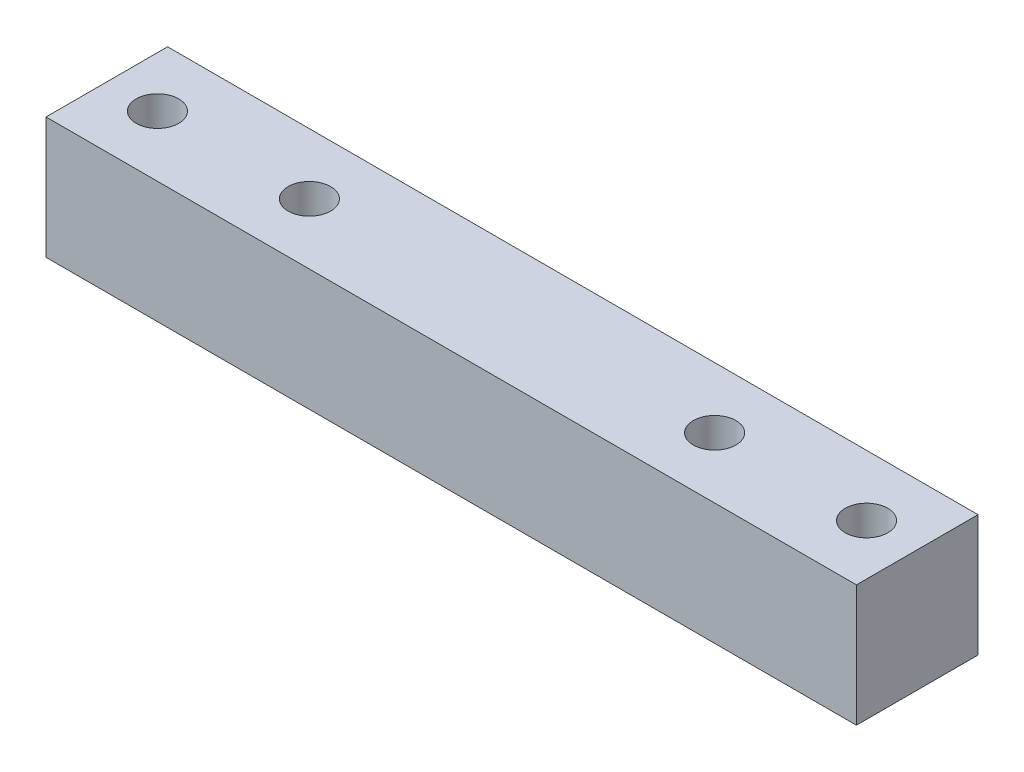
from build123d import *

# Parameters (mm, degrees)
SKETCH1_W           = 80
SKETCH1_H           = 12
BOSS_EXTRUDE1_DEPTH = 12
SKETCH2_R           = 2.1
CUT_EXTRUDE1_DEPTH  = 43.190046219
CUT_EXTRUDE8_DEPTH  = 0.2


with BuildPart() as part:
    # Sketch1 → Boss-Extrude1 (new body)
    with BuildSketch(Plane(origin=(0, 0, 0), x_dir=(1, 0, 0), z_dir=(0, 1, 0))):
        Rectangle(SKETCH1_W, SKETCH1_H)
    extrude(amount=BOSS_EXTRUDE1_DEPTH)

    # Sketch2 → Cut-Extrude1 (cut, through all)
    with BuildSketch(Plane(origin=(0, 12, 0), x_dir=(1, 0, 0), z_dir=(0, 1, 0))):
        with Locations((35, 0)):
            Circle(SKETCH2_R)
        with Locations((20, 0)):
            Circle(SKETCH2_R)
        with Locations((-20, 0)):
            Circle(SKETCH2_R)
        with Locations((-35, 0)):
            Circle(SKETCH2_R)
    extrude(amount=-CUT_EXTRUDE1_DEPTH, mode=Mode.SUBTRACT)

    # Sketch3 → Cut-Extrude8 (cut)
    with BuildSketch(Plane.ZY.offset(40)):
        Polygon((-3, 0), (0, 10.963509299), (3, 0), align=None)
    extrude(amount=-CUT_EXTRUDE8_DEPTH, mode=Mode.SUBTRACT)


solid = part.part
